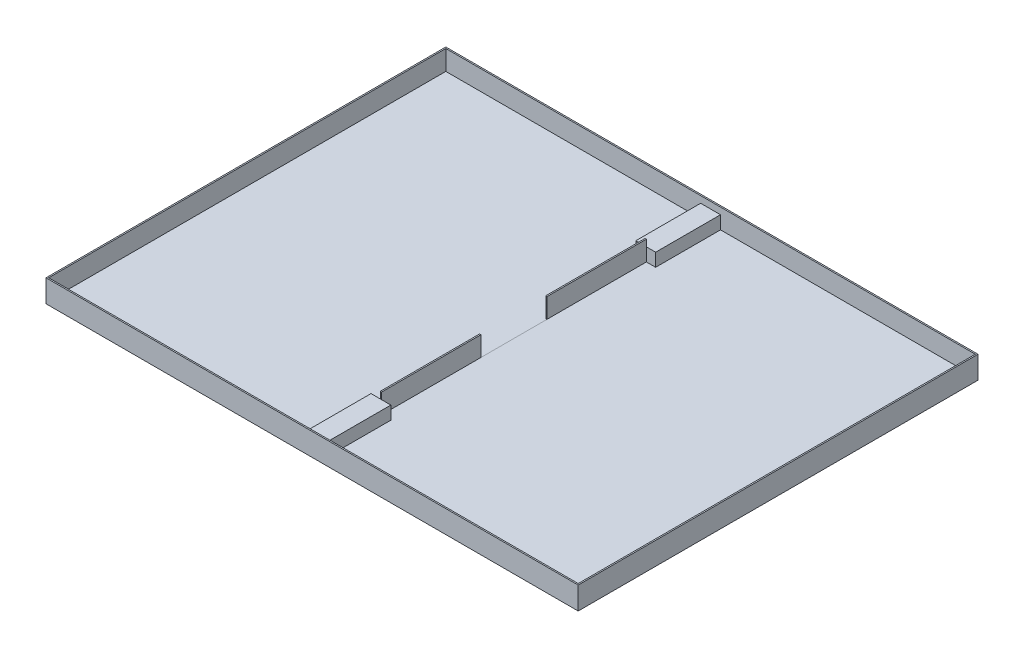
from build123d import *

# Parameters (mm, degrees)
ESBO_O1_W                = 4020
ESBO_O1_H                = 20
RESSALTO_EXTRUS_O1_DEPTH = 3020
ESBO_O2_W                = 4020
ESBO_O2_H                = 3020
ESBO_O2_W_2              = 4000
ESBO_O2_H_2              = 3000
ESBO_O2_W_3              = 10
ESBO_O2_H_3              = 750
RESSALTO_EXTRUS_O2_DEPTH = 150
ESBO_O3_W                = 150
ESBO_O3_H                = 490
ESBO_O3_H_2              = 510
RESSALTO_EXTRUS_O3_DEPTH = 100
ESBO_O4_W                = 1995
ESBO_O4_H                = 3000
RESSALTO_EXTRUS_O4_DEPTH = 1


with BuildPart() as part:
    # Esboço1 → Ressalto-extrusão1 (new body)
    with BuildSketch(Plane.XY):
        with Locations((1169.753435213, -142.12327558)):
            Rectangle(ESBO_O1_W, ESBO_O1_H)
    extrude(amount=RESSALTO_EXTRUS_O1_DEPTH)

    # Esboço2 → Ressalto-extrusão2 (add)
    # profile 1 of 3: a face of its own
    with BuildSketch(Plane(origin=(0, -132.12327558, 0), x_dir=(1, 0, 0), z_dir=(0, 1, 0))):
        with Locations((1169.753435213, -1510)):
            Rectangle(ESBO_O2_W, ESBO_O2_H)
        with Locations((1169.753435213, -1510)):
            Rectangle(ESBO_O2_W_2, ESBO_O2_H_2, mode=Mode.SUBTRACT)
    # profile 2 of 3: a face of its own
    with BuildSketch(Plane(origin=(0, -132.12327558, 0), x_dir=(1, 0, 0), z_dir=(0, 1, 0))):
        with Locations((1169.753435213, -875)):
            Rectangle(ESBO_O2_W_3, ESBO_O2_H_3)
    # profile 3 of 3: a face of its own
    with BuildSketch(Plane(origin=(0, -132.12327558, 0), x_dir=(1, 0, 0), z_dir=(0, 1, 0))):
        with Locations((1169.753435213, -2125)):
            Rectangle(ESBO_O2_W_3, ESBO_O2_H_3)
    extrude(amount=RESSALTO_EXTRUS_O2_DEPTH)

    # Esboço3 → Ressalto-extrusão3 (add)
    with BuildSketch(Plane(origin=(0, -132.12327558, 0), x_dir=(1, 0, 0), z_dir=(0, 1, 0))):
        with Locations((1169.753435213, -255)):
            Rectangle(ESBO_O3_W, ESBO_O3_H)
        with Locations((1169.753435213, -2755)):
            Rectangle(ESBO_O3_W, ESBO_O3_H_2)
    extrude(amount=RESSALTO_EXTRUS_O3_DEPTH)

    # Esboço4 → Ressalto-extrusão4 (add)
    with BuildSketch(Plane(origin=(0, -132.12327558, 0), x_dir=(1, 0, 0), z_dir=(0, 1, 0))):
        with Locations((2172.253435213, -1510)):
            Rectangle(ESBO_O4_W, ESBO_O4_H)
    extrude(amount=RESSALTO_EXTRUS_O4_DEPTH)


solid = part.part
